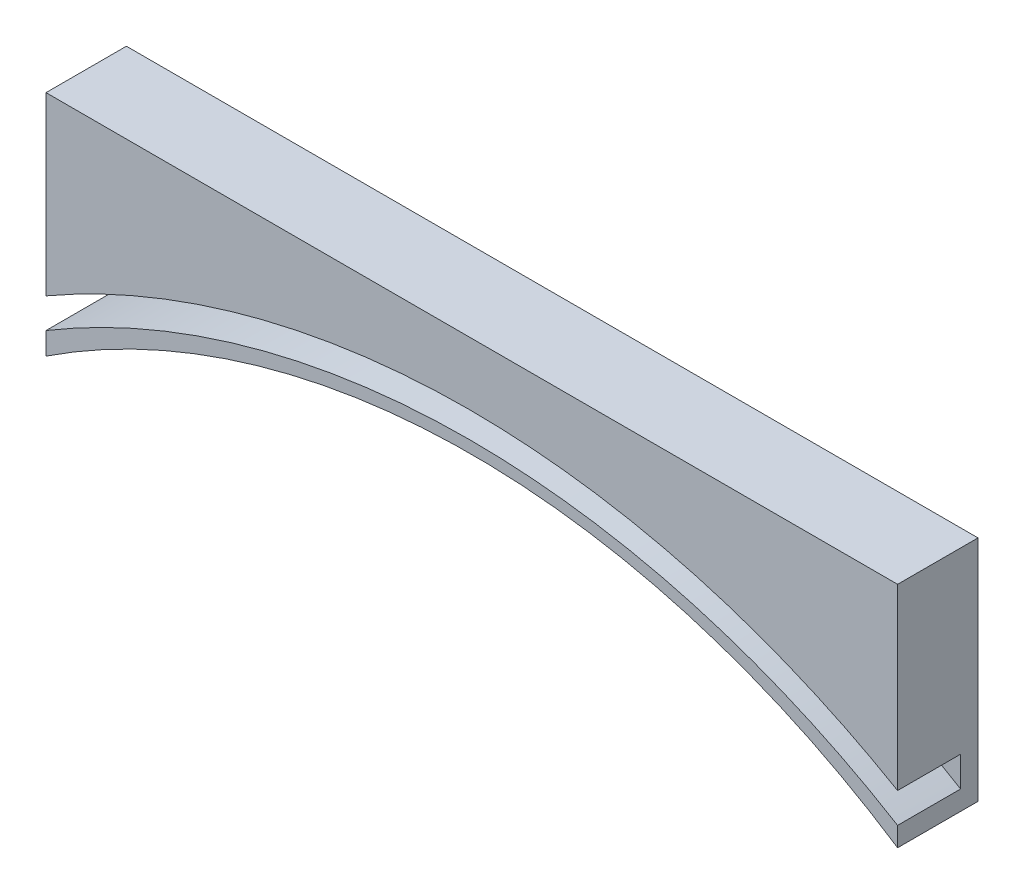
from build123d import *

# Parameters (mm, degrees)
SKETCH1_W           = 169.5
SKETCH1_H           = 47.45
BOSS_EXTRUDE1_DEPTH = 32
SKETCH7_R           = 154
CUT_EXTRUDE5_DEPTH  = 32
SKETCH14_W          = 169.5
SKETCH14_H          = 16
BOSS_EXTRUDE2_DEPTH = 10


with BuildPart() as part:
    # Sketch1 → Boss-Extrude1 (new body)
    with BuildSketch(Plane.XY):
        with Locations((-3.10671108, -121.862113139)):
            Rectangle(SKETCH1_W, SKETCH1_H)
    extrude(amount=BOSS_EXTRUDE1_DEPTH)

    # Sketch7 → Cut-Extrude5 (cut)
    with BuildSketch(Plane.XY.offset(32)):
        with Locations((-3.10671108, -262.137113139)):
            Circle(SKETCH7_R)
    extrude(amount=-CUT_EXTRUDE5_DEPTH, mode=Mode.SUBTRACT)

    # Split2
    split(bisect_by=Plane(origin=(0, 0, 16), x_dir=(-1, 0, 0), z_dir=(0, 0, -1)), keep=Keep.TOP)

    # Cut-Sweep4: read off the stored shape, not the designer's step
    # Cut-Sweep4: loft between two sections, ruled curve by curve
    cut_sweep4_from = [
        Edge.make_bspline([(82.739791111, -124.333714197, 3.462903079), (82.375516408, -124.117363235, 3.462903079), (82.0018328, -123.896841508, 3.462903079), (68.621301032, -116.090106709, 3.462903079), (54.256669748, -110.065617594, 3.462903079), (24.029677947, -102.175579118, 3.462903079), (8.210854863, -100.312946687, 3.462903079), (-23.222204489, -101.051424681, 3.462903079), (-38.798228939, -103.637289837, 3.462903079), (-60.809960607, -110.444286671, 3.462903079), (-67.919122803, -113.18910099, 3.462903079), (-81.548905499, -119.521573676, 3.462903079), (-88.057522246, -123.118344791, 3.46290308), (-94.217927223, -127.000728785, 3.462903079)], [0, 0, 0, 0, 0.006836374, 0.006836374, 0.255127281, 0.255127281, 0.503418187, 0.503418187, 0.751709094, 0.751709094, 0.875854547, 0.875854547, 1, 1, 1, 1], 3),
        Edge.make_bspline([(82.696209972, -130.333555919, 3.462903079), (82.346471994, -130.117236359, 3.462903079), (81.986625524, -129.896841507, 3.462903079), (69.173615468, -122.090106764, 3.46290308), (55.332198525, -115.995213643, 3.462903079), (26.189346767, -107.801652521, 3.462903079), (10.873507842, -105.719561423, 3.462903079), (-19.594281231, -105.863843686, 3.462903079), (-34.749935159, -108.099853973, 3.462903079), (-56.203233344, -114.298356521, 3.462903079), (-63.148715446, -116.838422053, 3.462903079), (-76.467195094, -122.723221567, 3.462903079), (-82.839914651, -126.093721608, 3.462903079), (-88.893908679, -129.767464505, 3.462903079)], [0, 0, 0, 0, 0.006836374, 0.006836374, 0.255127281, 0.255127281, 0.503418187, 0.503418187, 0.751709094, 0.751709094, 0.875854547, 0.875854547, 1, 1, 1, 1], 3),
        Edge.make_line((-88.893908679, -129.767464505, 3.462903079), (-94.217927223, -127.000728785, 3.462903079)),
        Edge.make_line((82.696209972, -130.333555919, 3.462903079), (82.739791111, -124.333714197, 3.462903079)),
    ]
    cut_sweep4_to = [
        Edge.make_bspline([(82.739791111, -124.333714197, 16.002903079), (82.375516408, -124.117363235, 16.002903079), (82.0018328, -123.896841508, 16.002903079), (68.621301031, -116.090106708, 16.002903079), (54.256669748, -110.065617594, 16.002903079), (24.029677947, -102.175579118, 16.002903079), (8.210854863, -100.312946687, 16.002903079), (-23.222204489, -101.051424681, 16.002903079), (-38.798228939, -103.637289837, 16.00290308), (-60.809960607, -110.444286671, 16.002903079), (-67.919122803, -113.18910099, 16.002903079), (-81.548905499, -119.521573676, 16.002903079), (-88.057522246, -123.118344791, 16.002903079), (-94.217927223, -127.000728785, 16.002903079)], [0, 0, 0, 0, 0.006836374, 0.006836374, 0.255127281, 0.255127281, 0.503418187, 0.503418187, 0.751709094, 0.751709094, 0.875854547, 0.875854547, 1, 1, 1, 1], 3),
        Edge.make_bspline([(82.696209972, -130.333555919, 16.002903079), (82.346471994, -130.117236359, 16.002903079), (81.986625524, -129.896841507, 16.002903079), (69.173615467, -122.090106763, 16.00290308), (55.332198525, -115.995213643, 16.002903079), (26.189346767, -107.801652521, 16.002903079), (10.873507842, -105.719561423, 16.002903079), (-19.594281231, -105.863843686, 16.002903079), (-34.749935159, -108.099853973, 16.00290308), (-56.203233344, -114.298356521, 16.002903079), (-63.148715446, -116.838422053, 16.002903079), (-76.467195094, -122.723221567, 16.002903079), (-82.839914651, -126.093721608, 16.002903079), (-88.893908679, -129.767464505, 16.002903079)], [0, 0, 0, 0, 0.006836374, 0.006836374, 0.255127281, 0.255127281, 0.503418187, 0.503418187, 0.751709094, 0.751709094, 0.875854547, 0.875854547, 1, 1, 1, 1], 3),
        Edge.make_line((-88.893908679, -129.767464505, 16.002903079), (-94.217927223, -127.000728785, 16.002903079)),
        Edge.make_line((82.696209972, -130.333555919, 16.002903079), (82.739791111, -124.333714197, 16.002903079)),
    ]
    cut_sweep4 = Solid(Shell([*[Face.make_surface_from_curves(cut_sweep4_from[k], cut_sweep4_to[k]) for k in range(4)], Face(Wire(cut_sweep4_from)), Face(Wire(cut_sweep4_to))]))
    add(cut_sweep4, mode=Mode.SUBTRACT)

    # Sketch14 → Boss-Extrude2 (add)
    with BuildSketch(Plane(origin=(0, -98.137113139, 0), x_dir=(1, 0, 0), z_dir=(0, 1, 0))):
        with Locations((-3.10671108, -8)):
            Rectangle(SKETCH14_W, SKETCH14_H)
    extrude(amount=BOSS_EXTRUDE2_DEPTH)


solid = part.part
